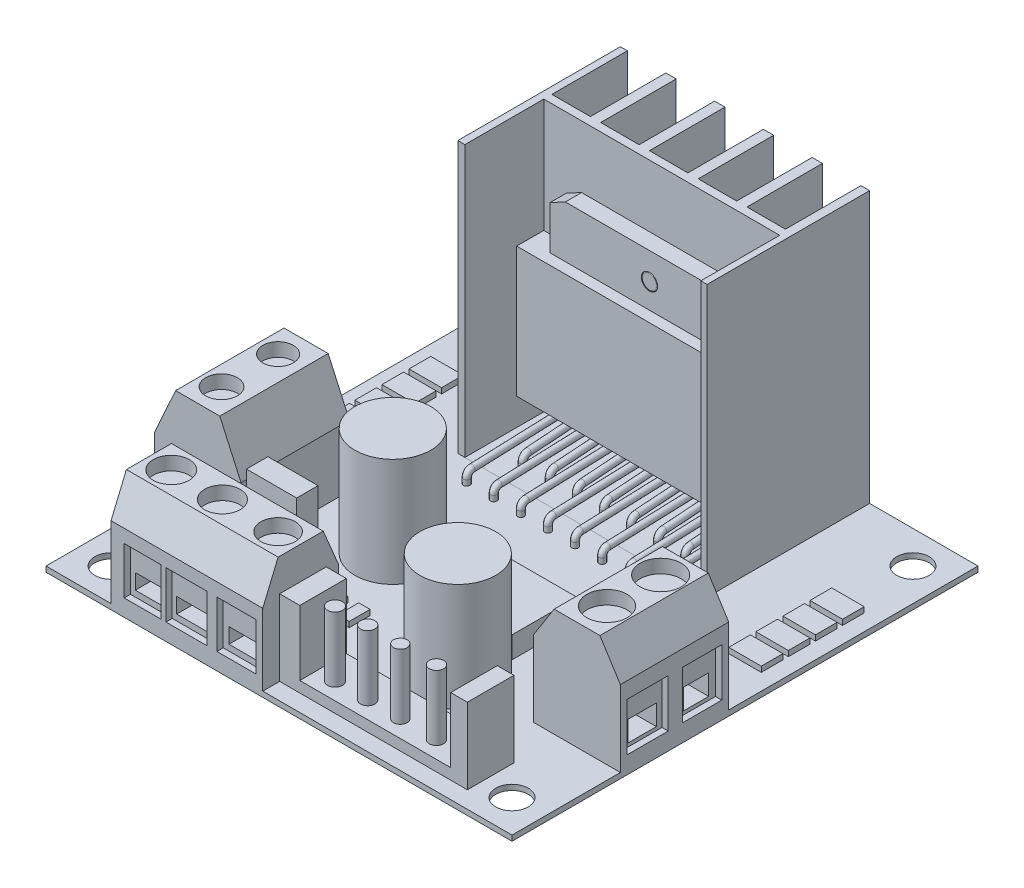
from build123d import *
from OCP.BRepAlgoAPI import BRepAlgoAPI_Cut
from OCP.TopTools import TopTools_ListOfShape

# Parameters (mm, degrees)
SKETCH1_R                   = 1.5
SKETCH1_W                   = 1.87674342
SKETCH1_H                   = 0.987767776
SKETCH1_W_2                 = 1.047117993
SKETCH1_H_2                 = 1.933140308
SKETCH1_W_3                 = 4.629363757
SKETCH1_H_3                 = 1.975535552
SKETCH1_R_2                 = 3.5
SKETCH1_W_4                 = 6
SKETCH1_H_4                 = 6
SKETCH1_W_5                 = 3
SKETCH1_H_5                 = 2
BOSS_EXTRUDE1_DEPTH         = 0.5
BOSS_EXTRUDE2_DEPTH         = 25
BOSS_EXTRUDE2_DEPTH_BACK    = 0.5
SKETCH1_3_W                 = 23
SKETCH1_3_H                 = 15
BOSS_EXTRUDE3_DEPTH         = 0.5
BOSS_EXTRUDE3_DEPTH_BACK    = 0.5
SKETCH1_4_W                 = 3
SKETCH1_4_H                 = 2
BOSS_EXTRUDE3_2_DEPTH       = 0.5
BOSS_EXTRUDE3_2_DEPTH_BACK  = 0.5
BOSS_EXTRUDE3_3_DEPTH       = 0.5
BOSS_EXTRUDE3_3_DEPTH_BACK  = 0.5
BOSS_EXTRUDE3_4_DEPTH       = 0.5
BOSS_EXTRUDE3_4_DEPTH_BACK  = 0.5
BOSS_EXTRUDE3_5_DEPTH       = 0.5
BOSS_EXTRUDE3_5_DEPTH_BACK  = 0.5
BOSS_EXTRUDE3_6_DEPTH       = 0.5
BOSS_EXTRUDE3_6_DEPTH_BACK  = 0.5
BOSS_EXTRUDE3_7_DEPTH       = 0.5
BOSS_EXTRUDE3_7_DEPTH_BACK  = 0.5
BOSS_EXTRUDE3_8_DEPTH       = 0.5
BOSS_EXTRUDE3_8_DEPTH_BACK  = 0.5
BOSS_EXTRUDE3_9_DEPTH       = 0.5
BOSS_EXTRUDE3_9_DEPTH_BACK  = 0.5
SKETCH1_4_W_2               = 1.87674342
SKETCH1_4_H_2               = 0.987767776
BOSS_EXTRUDE3_10_DEPTH      = 0.5
BOSS_EXTRUDE3_10_DEPTH_BACK = 0.5
SKETCH1_4_W_3               = 1.047117993
SKETCH1_4_H_3               = 1.933140308
BOSS_EXTRUDE4_DEPTH         = 10
BOSS_EXTRUDE4_DEPTH_BACK    = 0.5
SKETCH1_5_R                 = 3.5
SKETCH1_6_W                 = 6
SKETCH1_6_H                 = 6
BOSS_EXTRUDE5_DEPTH         = 2
BOSS_EXTRUDE6_DEPTH         = 10
BOSS_EXTRUDE6_DEPTH_BACK    = 0.5
SKETCH1_7_W                 = 8
SKETCH1_7_H                 = 10
BOSS_EXTRUDE7_DEPTH         = 7
BOSS_EXTRUDE7_DEPTH_BACK    = 0.5
SKETCH1_8_W                 = 4.629363757
SKETCH1_8_H                 = 1.975535552
SKETCH1_8_W_2               = 17.323100011
SKETCH1_8_H_2               = 4.298694917
SKETCH3_W                   = 21.77
SKETCH3_H                   = 7.281510675
SKETCH3_W_2                 = 3.55
SKETCH3_H_2                 = 6.968489325
CUT_EXTRUDE1_DEPTH          = 25
SKETCH4_W                   = 21.822211109
SKETCH4_H                   = 12
BOSS_EXTRUDE8_DEPTH         = 2.5
SKETCH4_4_R                 = 0.75
BOSS_EXTRUDE9_DEPTH         = 1.5
FILLET1_R                   = 0.1
SKETCH6_R                   = 0.3
LPATTERN1_COUNT             = 8
LPATTERN1_PITCH             = 2.5
SKETCH5_R                   = 0.3
SKETCH4_5_R                 = 0.75
SKETCH4_5_W                 = 15.556619177
SKETCH4_5_H                 = 0.75
BOSS_EXTRUDE10_DEPTH        = 1.5
LPATTERN3_COUNT             = 8
LPATTERN3_PITCH             = 2.5
CUT_EXTRUDE2_DEPTH          = 13.999997
CUT_EXTRUDE3_DEPTH          = 10
CUT_EXTRUDE4_DEPTH          = 10
SKETCH14_W                  = 3.41974787
SKETCH14_H                  = 4.353350778
SKETCH14_W_2                = 3.775326231
SKETCH14_W_3                = 3.586931724
CUT_EXTRUDE6_DEPTH          = 4
SKETCH14_4_W                = 2.577830683
SKETCH14_4_H                = 1.413175893
SKETCH14_4_W_2              = 2.832001647
SKETCH14_4_W_3              = 2.538676019
CUT_EXTRUDE7_DEPTH          = 8
SKETCH15_W                  = 3.998228422
SKETCH15_H                  = 3.998228422
SKETCH15_W_2                = 3.023453724
SKETCH15_H_2                = 1.751290135
SKETCH15_W_3                = 3.816490766
SKETCH15_W_4                = 2.858237673
CUT_EXTRUDE8_DEPTH          = 1.5
SKETCH15_3_W                = 3.023453724
SKETCH15_3_H                = 1.751290135
SKETCH15_3_W_2              = 2.858237673
CUT_EXTRUDE9_DEPTH          = 3
SKETCH16_W                  = 3.796371446
SKETCH16_H                  = 4.433469185
SKETCH16_W_2                = 2.614326261
SKETCH16_H_2                = 1.892862173
SKETCH16_W_3                = 3.633009451
SKETCH16_W_4                = 2.335219141
CUT_EXTRUDE10_DEPTH         = 4
SKETCH16_3_W                = 2.614326261
SKETCH16_3_H                = 1.892862173
SKETCH16_3_W_2              = 2.335219141
CUT_EXTRUDE11_DEPTH         = 6
SKETCH17_W                  = 13.929053026
SKETCH17_H                  = 4.430880335
SKETCH17_R                  = 0.691969211
SKETCH17_R_2                = 0.664358057
SKETCH17_R_3                = 0.628537192
SKETCH17_R_4                = 0.66230563
CUT_EXTRUDE12_DEPTH         = 6
SKETCH18_R                  = 1.657866538
SKETCH18_R_2                = 1.635373105
SKETCH18_R_3                = 1.587041844
SKETCH18_R_4                = 1.460606867
SKETCH18_R_5                = 1.406099569
SKETCH18_R_6                = 1.895957692
SKETCH18_R_7                = 1.86639443
CUT_EXTRUDE13_DEPTH         = 1.25


with BuildPart() as part:
    # Sketch1 → Boss-Extrude1 (new body)
    with BuildSketch(Plane(origin=(0, 0, 0), x_dir=(1, 0, 0), z_dir=(0, 1, 0))):
        Polygon((21.780262734, 9.055650914), (21.780262734, 32.055650914), (11.780262734, 32.055650914), (11.780262734, 17.055650914), (-11.219737266, 17.055650914), (-11.219737266, 32.055650914), (-21.219737266, 32.055650914), (-21.219737266, 9.055650914), (-13.219737266, 9.055650914), (-13.219737266, -0.944349086), (-21.219737266, -0.944349086), (-21.219737266, -10.944349086), (-15.219737266, -10.944349086), (-15.219737266, -3.944349086), (-1.219737266, -3.944349086), (-1.219737266, -5.086187069), (16.103362745, -5.086187069), (16.103362745, -9.384881986), (-1.219737266, -9.384881986), (-1.219737266, -10.944349086), (21.780262734, -10.944349086), (21.780262734, -0.944349086), (13.780262734, -0.944349086), (13.780262734, 9.055650914), align=None)
        with Locations(Location((-18.219737266, -7.944349086, 0), (0, 0, 270))):
            Circle(SKETCH1_R, mode=Mode.SUBTRACT)
        with Locations((-5.281365556, -0.450465198)):
            Rectangle(SKETCH1_W, SKETCH1_H, mode=Mode.SUBTRACT)
        with Locations((-2.827428331, -0.923151464)):
            Rectangle(SKETCH1_W_2, SKETCH1_H_2, mode=Mode.SUBTRACT)
        with Locations((-10.405255909, 0.04341869)):
            Rectangle(SKETCH1_W_3, SKETCH1_H_3, mode=Mode.SUBTRACT)
        with Locations(Location((-6.219737266, 6.055650914, 0), (0, 0, 270))):
            Circle(SKETCH1_R_2, mode=Mode.SUBTRACT)
        with Locations(Location((6.780262734, -0.944349086, 0), (0, 0, 270))):
            Circle(SKETCH1_R_2, mode=Mode.SUBTRACT)
        with Locations(Location((18.780262734, -7.944349086, 0), (0, 0, 270))):
            Circle(SKETCH1_R, mode=Mode.SUBTRACT)
        with Locations((4.780262734, 6.055650914)):
            Rectangle(SKETCH1_W_4, SKETCH1_H_4, mode=Mode.SUBTRACT)
        with Locations((-18.219737266, 14.555650914)):
            Rectangle(SKETCH1_W_5, SKETCH1_H_5, mode=Mode.SUBTRACT)
        with Locations((-18.219737266, 17.055650914)):
            Rectangle(SKETCH1_W_5, SKETCH1_H_5, mode=Mode.SUBTRACT)
        with Locations((-18.219737266, 19.555650914)):
            Rectangle(SKETCH1_W_5, SKETCH1_H_5, mode=Mode.SUBTRACT)
        with Locations((-18.219737266, 22.055650914)):
            Rectangle(SKETCH1_W_5, SKETCH1_H_5, mode=Mode.SUBTRACT)
        with Locations(Location((-18.219737266, 29.055650914, 0), (0, 0, 270))):
            Circle(SKETCH1_R, mode=Mode.SUBTRACT)
        with Locations((18.780262734, 14.555650914)):
            Rectangle(SKETCH1_W_5, SKETCH1_H_5, mode=Mode.SUBTRACT)
        with Locations((18.780262734, 17.055650914)):
            Rectangle(SKETCH1_W_5, SKETCH1_H_5, mode=Mode.SUBTRACT)
        with Locations((18.780262734, 19.555650914)):
            Rectangle(SKETCH1_W_5, SKETCH1_H_5, mode=Mode.SUBTRACT)
        with Locations((18.780262734, 22.055650914)):
            Rectangle(SKETCH1_W_5, SKETCH1_H_5, mode=Mode.SUBTRACT)
        with Locations(Location((18.780262734, 29.055650914, 0), (0, 0, 270))):
            Circle(SKETCH1_R, mode=Mode.SUBTRACT)
    extrude(amount=-BOSS_EXTRUDE1_DEPTH)

    # Sketch1<5> → Boss-Extrude4 (add, two sides: drawn at the far end of the back side and taken through both)
    with BuildSketch(Plane(origin=(0, 0, 0), x_dir=(1, 0, 0), z_dir=(0, 1, 0)).offset(-BOSS_EXTRUDE4_DEPTH_BACK)):
        with Locations(Location((-6.219737266, 6.055650914, 0), (0, 0, 270))):
            Circle(SKETCH1_5_R)
        with Locations(Location((6.780262734, -0.944349086, 0), (0, 0, 270))):
            Circle(SKETCH1_5_R)
    extrude(amount=BOSS_EXTRUDE4_DEPTH + BOSS_EXTRUDE4_DEPTH_BACK)

    # Sketch1<7> → Boss-Extrude6 (add, two sides: drawn at the far end of the back side and taken through both)
    with BuildSketch(Plane(origin=(0, 0, 0), x_dir=(1, 0, 0), z_dir=(0, 1, 0)).offset(-BOSS_EXTRUDE6_DEPTH_BACK)):
        with Locations((-17.219737266, 4.055650914)):
            Rectangle(SKETCH1_7_W, SKETCH1_7_H)
        with Locations((17.780262734, 4.055650914)):
            Rectangle(SKETCH1_7_W, SKETCH1_7_H)
        Polygon((-15.219737266, -10.944349086), (-1.219737266, -10.944349086), (-1.219737266, -9.384881986), (-1.219737266, -5.086187069), (-1.219737266, -3.944349086), (-15.219737266, -3.944349086), align=None)
    extrude(amount=BOSS_EXTRUDE6_DEPTH + BOSS_EXTRUDE6_DEPTH_BACK)

    # Sketch1<8> → Boss-Extrude7 (add, two sides: drawn at the far end of the back side and taken through both)
    with BuildSketch(Plane(origin=(0, 0, 0), x_dir=(1, 0, 0), z_dir=(0, 1, 0)).offset(-BOSS_EXTRUDE7_DEPTH_BACK)):
        with Locations((-10.405255909, 0.04341869)):
            Rectangle(SKETCH1_8_W, SKETCH1_8_H)
        with Locations((7.44181274, -7.235534528)):
            Rectangle(SKETCH1_8_W_2, SKETCH1_8_H_2)
    extrude(amount=BOSS_EXTRUDE7_DEPTH + BOSS_EXTRUDE7_DEPTH_BACK)


with BuildPart() as body_2:
    # Sketch1<3> → Boss-Extrude2 (new, two sides: drawn at the far end of the back side and taken through both)
    with BuildSketch(Plane(origin=(0, 0, 0), x_dir=(1, 0, 0), z_dir=(0, 1, 0)).offset(-BOSS_EXTRUDE2_DEPTH_BACK)):
        with Locations((0.280262734, 24.555650914)):
            Rectangle(SKETCH1_3_W, SKETCH1_3_H)
    extrude(amount=BOSS_EXTRUDE2_DEPTH + BOSS_EXTRUDE2_DEPTH_BACK)

    # Sketch3 → Cut-Extrude1 (cut)
    with BuildSketch(Plane(origin=(0, 25, 0), x_dir=(1, 0, 0), z_dir=(0, 1, 0))):
        with Locations((0.315262734, 20.696406252)):
            Rectangle(SKETCH3_W, SKETCH3_H)
        with Locations((-8.794737266, 28.571406252)):
            Rectangle(SKETCH3_W_2, SKETCH3_H_2)
        with Locations((-4.294737266, 28.571406252)):
            Rectangle(SKETCH3_W_2, SKETCH3_H_2)
        with Locations((0.205262734, 28.571406252)):
            Rectangle(SKETCH3_W_2, SKETCH3_H_2)
        with Locations((4.705262734, 28.571406252)):
            Rectangle(SKETCH3_W_2, SKETCH3_H_2)
        with Locations((9.205262734, 28.571406252)):
            Rectangle(SKETCH3_W_2, SKETCH3_H_2)
    extrude(amount=-CUT_EXTRUDE1_DEPTH, mode=Mode.SUBTRACT)

    # Sketch4 → Boss-Extrude8 (add)
    with BuildSketch(Plane.XY.offset(-24.337161589)):
        with Locations((0.28915718, 8.5)):
            Rectangle(SKETCH4_W, SKETCH4_H)
    extrude(amount=BOSS_EXTRUDE8_DEPTH)

    # Sketch4<4> → Boss-Extrude9 (add)
    with BuildSketch(Plane.XY.offset(-24.337161589)):
        with Locations(Location((0.681821006, 16.777489386, 0), (0, 0, 180))):
            Circle(SKETCH4_4_R)
    extrude(amount=BOSS_EXTRUDE9_DEPTH)

    # Fillet1
    fillet1_edges = [body_2.edges().sort_by_distance(p)[0] for p in [
        (1.431821006, 16.777489386, -22.837161589),
    ]]
    fillet(fillet1_edges, radius=FILLET1_R)

    # Sweep8: sweep along a path in Sketch7
    with BuildLine(Plane(origin=(-8.399737266, 0, 0), x_dir=(0, 0, -1), z_dir=(1, 0, 0))) as sweep8_path:
        Line((15.055650914, 0), (15.055650914, 0.501421112))
        ThreePointArc((15.055650914, 0.501421112), (15.195620266, 0.848376345), (15.537162646, 1.00107918))
        Line((15.537162646, 1.00107918), (24.345631529, 1.327008729))
    # Sketch6 → Sweep8 (sweep)
    with BuildSketch(Plane(origin=(0, 0, 0), x_dir=(1, 0, 0), z_dir=(0, 1, 0))):
        with Locations((-8.399737266, 15.055650914)):
            Circle(SKETCH6_R)
    sweep8 = sweep(path=sweep8_path.line)

    # LPattern1: Sweep8 ×8
    with Locations(*[(i * LPATTERN1_PITCH, 0, 0) for i in range(1, LPATTERN1_COUNT)]):
        add(sweep8)

    # Sweep9: sweep along a path in Sketch8
    with BuildLine(Plane(origin=(-7.149737266, 0, 0), x_dir=(0, 0, -1), z_dir=(1, 0, 0))) as sweep9_path:
        Line((24.337161589, 1.279338171), (19.464772885, 0.931582315))
        ThreePointArc((19.464772885, 0.931582315), (19.134446652, 0.773587017), (19.000368719, 0.432850988))
        Line((19.000368719, 0.432850988), (19.000368719, 0))
    # Sketch5 → Sweep9 (sweep)
    with BuildSketch(Plane.XY.offset(-24.337161589)):
        with Locations((-7.146603085, 1.311245351)):
            Circle(SKETCH5_R)
    sweep9 = sweep(path=sweep9_path.line)

    # Sketch4<5> → Boss-Extrude10 (add)
    # profile 1 of 4: a face of its own
    with BuildSketch(Plane.XY.offset(-24.337161589)):
        Polygon((-8.485442602, 14.5), (9.681821006, 14.5), (9.681821006, 18.522120271), (8.475876315, 18.522120271), (-7.080742862, 18.522120271), (-8.485442602, 18.522120271), align=None)
        with Locations((0.681821006, 16.777489386)):
            Circle(SKETCH4_5_R, mode=Mode.SUBTRACT)
    # profile 2 of 4: a face of its own
    with BuildSketch(Plane.XY.offset(-24.337161589)):
        with Locations((0.697566727, 18.897120271)):
            Rectangle(SKETCH4_5_W, SKETCH4_5_H)
    # profile 3 of 4: a face of its own
    with BuildSketch(Plane.XY.offset(-24.337161589)):
        Polygon((-7.080742862, 19.272120271), (-8.485442602, 18.522120271), (-7.080742862, 18.522120271), align=None)
    # profile 4 of 4: a face of its own
    with BuildSketch(Plane.XY.offset(-24.337161589)):
        Polygon((8.475876315, 18.522120271), (9.681821006, 18.522120271), (8.475876315, 19.272120271), align=None)
    extrude(amount=BOSS_EXTRUDE10_DEPTH)

    # LPattern3: Sweep9 ×8
    with Locations(*[(i * LPATTERN3_PITCH, 0, 0) for i in range(1, LPATTERN3_COUNT)]):
        add(sweep9)


with BuildPart() as body_3:
    # Sketch1<4> → Boss-Extrude3 (new, two sides: drawn at the far end of the back side and taken through both)
    with BuildSketch(Plane(origin=(0, 0, 0), x_dir=(1, 0, 0), z_dir=(0, 1, 0)).offset(-BOSS_EXTRUDE3_DEPTH_BACK)):
        with Locations((18.780262734, 22.055650914)):
            Rectangle(SKETCH1_4_W, SKETCH1_4_H)
    extrude(amount=BOSS_EXTRUDE3_DEPTH + BOSS_EXTRUDE3_DEPTH_BACK)


with BuildPart() as body_4:
    # Sketch1<4> → Boss-Extrude3 2 (new, two sides: drawn at the far end of the back side and taken through both)
    with BuildSketch(Plane(origin=(0, 0, 0), x_dir=(1, 0, 0), z_dir=(0, 1, 0)).offset(-BOSS_EXTRUDE3_2_DEPTH_BACK)):
        with Locations((18.780262734, 19.555650914)):
            Rectangle(SKETCH1_4_W, SKETCH1_4_H)
    extrude(amount=BOSS_EXTRUDE3_2_DEPTH + BOSS_EXTRUDE3_2_DEPTH_BACK)


with BuildPart() as body_5:
    # Sketch1<4> → Boss-Extrude3 3 (new, two sides: drawn at the far end of the back side and taken through both)
    with BuildSketch(Plane(origin=(0, 0, 0), x_dir=(1, 0, 0), z_dir=(0, 1, 0)).offset(-BOSS_EXTRUDE3_3_DEPTH_BACK)):
        with Locations((18.780262734, 17.055650914)):
            Rectangle(SKETCH1_4_W, SKETCH1_4_H)
    extrude(amount=BOSS_EXTRUDE3_3_DEPTH + BOSS_EXTRUDE3_3_DEPTH_BACK)


with BuildPart() as body_6:
    # Sketch1<4> → Boss-Extrude3 4 (new, two sides: drawn at the far end of the back side and taken through both)
    with BuildSketch(Plane(origin=(0, 0, 0), x_dir=(1, 0, 0), z_dir=(0, 1, 0)).offset(-BOSS_EXTRUDE3_4_DEPTH_BACK)):
        with Locations((18.780262734, 14.555650914)):
            Rectangle(SKETCH1_4_W, SKETCH1_4_H)
    extrude(amount=BOSS_EXTRUDE3_4_DEPTH + BOSS_EXTRUDE3_4_DEPTH_BACK)


with BuildPart() as body_7:
    # Sketch1<4> → Boss-Extrude3 5 (new, two sides: drawn at the far end of the back side and taken through both)
    with BuildSketch(Plane(origin=(0, 0, 0), x_dir=(1, 0, 0), z_dir=(0, 1, 0)).offset(-BOSS_EXTRUDE3_5_DEPTH_BACK)):
        with Locations((-18.219737266, 22.055650914)):
            Rectangle(SKETCH1_4_W, SKETCH1_4_H)
    extrude(amount=BOSS_EXTRUDE3_5_DEPTH + BOSS_EXTRUDE3_5_DEPTH_BACK)


with BuildPart() as body_8:
    # Sketch1<4> → Boss-Extrude3 6 (new, two sides: drawn at the far end of the back side and taken through both)
    with BuildSketch(Plane(origin=(0, 0, 0), x_dir=(1, 0, 0), z_dir=(0, 1, 0)).offset(-BOSS_EXTRUDE3_6_DEPTH_BACK)):
        with Locations((-18.219737266, 19.555650914)):
            Rectangle(SKETCH1_4_W, SKETCH1_4_H)
    extrude(amount=BOSS_EXTRUDE3_6_DEPTH + BOSS_EXTRUDE3_6_DEPTH_BACK)


with BuildPart() as body_9:
    # Sketch1<4> → Boss-Extrude3 7 (new, two sides: drawn at the far end of the back side and taken through both)
    with BuildSketch(Plane(origin=(0, 0, 0), x_dir=(1, 0, 0), z_dir=(0, 1, 0)).offset(-BOSS_EXTRUDE3_7_DEPTH_BACK)):
        with Locations((-18.219737266, 17.055650914)):
            Rectangle(SKETCH1_4_W, SKETCH1_4_H)
    extrude(amount=BOSS_EXTRUDE3_7_DEPTH + BOSS_EXTRUDE3_7_DEPTH_BACK)


with BuildPart() as body_10:
    # Sketch1<4> → Boss-Extrude3 8 (new, two sides: drawn at the far end of the back side and taken through both)
    with BuildSketch(Plane(origin=(0, 0, 0), x_dir=(1, 0, 0), z_dir=(0, 1, 0)).offset(-BOSS_EXTRUDE3_8_DEPTH_BACK)):
        with Locations((-18.219737266, 14.555650914)):
            Rectangle(SKETCH1_4_W, SKETCH1_4_H)
    extrude(amount=BOSS_EXTRUDE3_8_DEPTH + BOSS_EXTRUDE3_8_DEPTH_BACK)


with BuildPart() as body_11:
    # Sketch1<4> → Boss-Extrude3 9 (new, two sides: drawn at the far end of the back side and taken through both)
    with BuildSketch(Plane(origin=(0, 0, 0), x_dir=(1, 0, 0), z_dir=(0, 1, 0)).offset(-BOSS_EXTRUDE3_9_DEPTH_BACK)):
        with Locations((-5.281365556, -0.450465198)):
            Rectangle(SKETCH1_4_W_2, SKETCH1_4_H_2)
    extrude(amount=BOSS_EXTRUDE3_9_DEPTH + BOSS_EXTRUDE3_9_DEPTH_BACK)


with BuildPart() as body_12:
    # Sketch1<4> → Boss-Extrude3 10 (new, two sides: drawn at the far end of the back side and taken through both)
    with BuildSketch(Plane(origin=(0, 0, 0), x_dir=(1, 0, 0), z_dir=(0, 1, 0)).offset(-BOSS_EXTRUDE3_10_DEPTH_BACK)):
        with Locations((-2.827428331, -0.923151464)):
            Rectangle(SKETCH1_4_W_3, SKETCH1_4_H_3)
    extrude(amount=BOSS_EXTRUDE3_10_DEPTH + BOSS_EXTRUDE3_10_DEPTH_BACK)


with BuildPart() as body_13:
    # Sketch1<6> → Boss-Extrude5 (new body)
    with BuildSketch(Plane(origin=(0, 0, 0), x_dir=(1, 0, 0), z_dir=(0, 1, 0))):
        with Locations((4.780262734, 6.055650914)):
            Rectangle(SKETCH1_6_W, SKETCH1_6_H)
    extrude(amount=BOSS_EXTRUDE5_DEPTH)


with BuildPart() as cut_extrude2_tool:
    # Sketch10 → Cut-Extrude2 (new body)
    with BuildSketch(Plane.ZY.offset(15.219737266)):
        Polygon((5.364896266, 10), (3.944349086, 6.621466278), (3.944349086, 10), align=None)
        Polygon((9.523801907, 10), (10.944349086, 6.621466278), (10.944349086, 10), align=None)
    extrude(amount=-CUT_EXTRUDE2_DEPTH)


with BuildPart() as part_1:
    add(part.part)

    # Cut-Extrude2: cut by cut_extrude2_tool, with a tolerance
    cut_extrude2_stock = TopTools_ListOfShape()
    cut_extrude2_stock.Append(part_1.part.wrapped)
    cut_extrude2_tools = TopTools_ListOfShape()
    cut_extrude2_tools.Append(cut_extrude2_tool.part.wrapped)
    cut_extrude2_cut = BRepAlgoAPI_Cut()
    cut_extrude2_cut.SetArguments(cut_extrude2_stock)
    cut_extrude2_cut.SetTools(cut_extrude2_tools)
    cut_extrude2_cut.SetFuzzyValue(0.00001)
    cut_extrude2_cut.Build()
    add(Compound.cast(cut_extrude2_cut.Shape()).solids(), mode=Mode.REPLACE)

    # Sketch12 → Cut-Extrude3 (cut)
    with BuildSketch(Plane.XY.offset(0.944349086)):
        Polygon((-21.219737266, 5.653655285), (-19.257613594, 10), (-21.219737266, 10), align=None)
        Polygon((-13.219737266, 10), (-13.219737266, 5.653655285), (-15.181860939, 10), align=None)
    extrude(amount=-CUT_EXTRUDE3_DEPTH, mode=Mode.SUBTRACT)

    # Sketch13 → Cut-Extrude4 (cut)
    with BuildSketch(Plane.XY.offset(0.944349086)):
        Polygon((19.890577675, 10), (21.780262734, 7.02358264), (21.780262734, 10), align=None)
        Polygon((13.780262734, 10), (15.669947792, 10), (13.780262734, 7.02358264), align=None)
    extrude(amount=-CUT_EXTRUDE4_DEPTH, mode=Mode.SUBTRACT)

    # Sketch14 → Cut-Extrude6 (cut)
    with BuildSketch(Plane.XY.offset(14.364349086)):
        with Locations((-12.297230548, 3.232786989)):
            Rectangle(SKETCH14_W, SKETCH14_H)
        with Locations((-8.262973542, 3.232786989)):
            Rectangle(SKETCH14_W_2, SKETCH14_H)
        with Locations((-3.654087822, 3.232786989)):
            Rectangle(SKETCH14_W_3, SKETCH14_H)
    extrude(amount=-CUT_EXTRUDE6_DEPTH, mode=Mode.SUBTRACT)

    # Sketch14<4> → Cut-Extrude7 (cut)
    with BuildSketch(Plane.XY.offset(14.364349086)):
        with Locations((-12.27107568, 2.314797916)):
            Rectangle(SKETCH14_4_W, SKETCH14_4_H)
        with Locations((-8.32290457, 2.314797916)):
            Rectangle(SKETCH14_4_W_2, SKETCH14_4_H)
        with Locations((-3.651315733, 2.314797916)):
            Rectangle(SKETCH14_4_W_3, SKETCH14_4_H)
    extrude(amount=-CUT_EXTRUDE7_DEPTH, mode=Mode.SUBTRACT)

    # Sketch15 → Cut-Extrude8 (cut)
    # profile 1 of 4: a face of its own
    with BuildSketch(Plane.ZY.offset(21.219737266)):
        with Locations((-6.608617191, 2.509843814)):
            Rectangle(SKETCH15_W, SKETCH15_H)
        with Locations((-6.567313179, 1.634198747)):
            Rectangle(SKETCH15_W_2, SKETCH15_H_2, mode=Mode.SUBTRACT)
    # profile 2 of 4: a face of its own
    with BuildSketch(Plane.ZY.offset(21.219737266)):
        with Locations((-6.567313179, 1.634198747)):
            Rectangle(SKETCH15_W_2, SKETCH15_H_2)
    # profile 3 of 4: a face of its own
    with BuildSketch(Plane.ZY.offset(21.219737266)):
        with Locations((-1.627353269, 2.509843814)):
            Rectangle(SKETCH15_W_3, SKETCH15_H)
        with Locations((-1.544745244, 1.634198747)):
            Rectangle(SKETCH15_W_4, SKETCH15_H_2, mode=Mode.SUBTRACT)
    # profile 4 of 4: a face of its own
    with BuildSketch(Plane.ZY.offset(21.219737266)):
        with Locations((-1.544745244, 1.634198747)):
            Rectangle(SKETCH15_W_4, SKETCH15_H_2)
    extrude(amount=-CUT_EXTRUDE8_DEPTH, mode=Mode.SUBTRACT)

    # Sketch15<3> → Cut-Extrude9 (cut)
    with BuildSketch(Plane.ZY.offset(21.219737266)):
        with Locations((-6.567313179, 1.634198747)):
            Rectangle(SKETCH15_3_W, SKETCH15_3_H)
        with Locations((-1.544745244, 1.634198747)):
            Rectangle(SKETCH15_3_W_2, SKETCH15_3_H)
    extrude(amount=-CUT_EXTRUDE9_DEPTH, mode=Mode.SUBTRACT)

    # Sketch16 → Cut-Extrude10 (cut)
    # profile 1 of 4: a face of its own
    with BuildSketch(Plane(origin=(25.200262734, 0, 0), x_dir=(0, 0, -1), z_dir=(1, 0, 0))):
        with Locations((1.57237227, 3.319441148)):
            Rectangle(SKETCH16_W, SKETCH16_H)
        with Locations((1.649660692, 2.37301006)):
            Rectangle(SKETCH16_W_2, SKETCH16_H_2, mode=Mode.SUBTRACT)
    # profile 2 of 4: a face of its own
    with BuildSketch(Plane(origin=(25.200262734, 0, 0), x_dir=(0, 0, -1), z_dir=(1, 0, 0))):
        with Locations((1.649660692, 2.37301006)):
            Rectangle(SKETCH16_W_2, SKETCH16_H_2)
    # profile 3 of 4: a face of its own
    with BuildSketch(Plane(origin=(25.200262734, 0, 0), x_dir=(0, 0, -1), z_dir=(1, 0, 0))):
        with Locations((6.603635893, 3.319441148)):
            Rectangle(SKETCH16_W_3, SKETCH16_H)
        with Locations((6.617436093, 2.37301006)):
            Rectangle(SKETCH16_W_4, SKETCH16_H_2, mode=Mode.SUBTRACT)
    # profile 4 of 4: a face of its own
    with BuildSketch(Plane(origin=(25.200262734, 0, 0), x_dir=(0, 0, -1), z_dir=(1, 0, 0))):
        with Locations((6.617436093, 2.37301006)):
            Rectangle(SKETCH16_W_4, SKETCH16_H_2)
    extrude(amount=-CUT_EXTRUDE10_DEPTH, mode=Mode.SUBTRACT)

    # Sketch16<3> → Cut-Extrude11 (cut)
    with BuildSketch(Plane(origin=(25.200262734, 0, 0), x_dir=(0, 0, -1), z_dir=(1, 0, 0))):
        with Locations((1.649660692, 2.37301006)):
            Rectangle(SKETCH16_3_W, SKETCH16_3_H)
        with Locations((6.617436093, 2.37301006)):
            Rectangle(SKETCH16_3_W_2, SKETCH16_3_H)
    extrude(amount=-CUT_EXTRUDE11_DEPTH, mode=Mode.SUBTRACT)

    # Sketch17 → Cut-Extrude12 (cut)
    with BuildSketch(Plane(origin=(0, 7, 0), x_dir=(1, 0, 0), z_dir=(0, 1, 0))):
        with Locations((7.601473887, -7.301627236)):
            Rectangle(SKETCH17_W, SKETCH17_H)
        with Locations(Location((2.31010845, -7.805187753, 0), (0, 0, 270))):
            Circle(SKETCH17_R, mode=Mode.SUBTRACT)
        with Locations(Location((5.321463737, -7.805187753, 0), (0, 0, 270))):
            Circle(SKETCH17_R_2, mode=Mode.SUBTRACT)
        with Locations(Location((8.334078171, -7.805187753, 0), (0, 0, 270))):
            Circle(SKETCH17_R_3, mode=Mode.SUBTRACT)
        with Locations(Location((11.67100182, -7.805187753, 0), (0, 0, 270))):
            Circle(SKETCH17_R_4, mode=Mode.SUBTRACT)
    extrude(amount=-CUT_EXTRUDE12_DEPTH, mode=Mode.SUBTRACT)

    # Sketch18 → Cut-Extrude13 (cut)
    with BuildSketch(Plane(origin=(0, 10, 0), x_dir=(1, 0, 0), z_dir=(0, 1, 0))):
        with Locations(Location((-13.118368013, -7.489992052, 0), (0, 0, 270))):
            Circle(SKETCH18_R)
        with Locations(Location((-8.398682935, -7.489992052, 0), (0, 0, 270))):
            Circle(SKETCH18_R_2)
        with Locations(Location((-3.260725332, -7.489992052, 0), (0, 0, 270))):
            Circle(SKETCH18_R_3)
        with Locations(Location((-17.447225534, 1.478648189, 0), (0, 0, 270))):
            Circle(SKETCH18_R_4)
        with Locations(Location((-17.447225534, 6.696831679, 0), (0, 0, 270))):
            Circle(SKETCH18_R_5)
        with Locations(Location((17.857868971, 6.696831679, 0), (0, 0, 270))):
            Circle(SKETCH18_R_6)
        with Locations(Location((17.857868971, 1.743546675, 0), (0, 0, 270))):
            Circle(SKETCH18_R_7)
    extrude(amount=-CUT_EXTRUDE13_DEPTH, mode=Mode.SUBTRACT)


solid = Compound([body_2.part, body_3.part, body_4.part, body_5.part, body_6.part, body_7.part, body_8.part, body_9.part, body_10.part, body_11.part, body_12.part, body_13.part, part_1.part])
